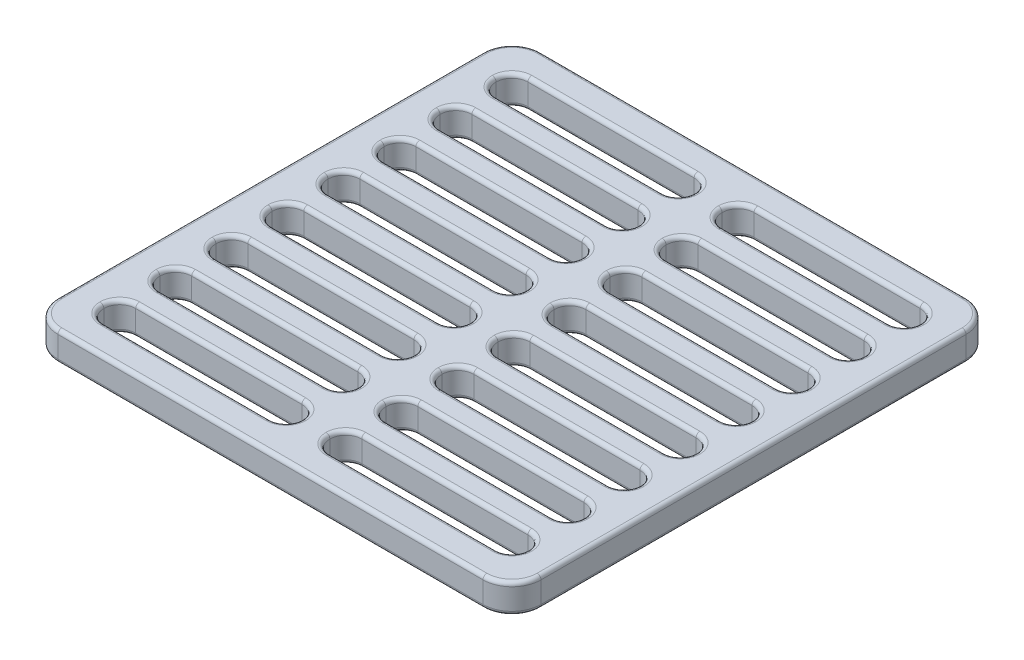
from build123d import *

# Parameters (mm, degrees)
SKETCH1_W           = 50
SKETCH1_H           = 50
BOSS_EXTRUDE1_DEPTH = 3
SKETCH4_W           = 20.5
SKETCH4_H           = 3.3
CUT_EXTRUDE2_DEPTH  = 3
FILLET3_R           = 1.65
FILLET1_R           = 3
FILLET2_R           = 0.4


with BuildPart() as part:
    # Sketch1 → Boss-Extrude1 (new body)
    with BuildSketch(Plane(origin=(0, 0, 0), x_dir=(1, 0, 0), z_dir=(0, 1, 0))):
        with Locations((25, -25)):
            Rectangle(SKETCH1_W, SKETCH1_H)
    extrude(amount=BOSS_EXTRUDE1_DEPTH)

    # Sketch4 → Cut-Extrude2 (cut)
    with BuildSketch(Plane(origin=(0, 3, 0), x_dir=(1, 0, 0), z_dir=(0, 1, 0))):
        with Locations((13.3, -4.7)):
            Rectangle(SKETCH4_W, SKETCH4_H)
        with Locations((36.7, -4.7)):
            Rectangle(SKETCH4_W, SKETCH4_H)
        with Locations((13.3, -10.5)):
            Rectangle(SKETCH4_W, SKETCH4_H)
        with Locations((36.7, -10.5)):
            Rectangle(SKETCH4_W, SKETCH4_H)
        with Locations((13.3, -16.3)):
            Rectangle(SKETCH4_W, SKETCH4_H)
        with Locations((36.7, -16.3)):
            Rectangle(SKETCH4_W, SKETCH4_H)
        with Locations((13.3, -22.1)):
            Rectangle(SKETCH4_W, SKETCH4_H)
        with Locations((36.7, -22.1)):
            Rectangle(SKETCH4_W, SKETCH4_H)
        with Locations((13.3, -27.9)):
            Rectangle(SKETCH4_W, SKETCH4_H)
        with Locations((36.7, -27.9)):
            Rectangle(SKETCH4_W, SKETCH4_H)
        with Locations((13.3, -33.7)):
            Rectangle(SKETCH4_W, SKETCH4_H)
        with Locations((36.7, -33.7)):
            Rectangle(SKETCH4_W, SKETCH4_H)
        with Locations((13.3, -39.5)):
            Rectangle(SKETCH4_W, SKETCH4_H)
        with Locations((36.7, -39.5)):
            Rectangle(SKETCH4_W, SKETCH4_H)
        with Locations((13.3, -45.3)):
            Rectangle(SKETCH4_W, SKETCH4_H)
        with Locations((36.7, -45.3)):
            Rectangle(SKETCH4_W, SKETCH4_H)
    extrude(amount=-CUT_EXTRUDE2_DEPTH, mode=Mode.SUBTRACT)

    # Fillet3
    fillet3_edges = [part.edges().sort_by_distance(p)[0] for p in [
        (23.55, 1.5, 3.05),
        (23.55, 1.5, 6.35),
        (3.05, 1.5, 6.35),
        (23.55, 1.5, 41.15),
        (3.05, 1.5, 41.15),
        (3.05, 1.5, 37.85),
        (23.55, 1.5, 37.85),
        (46.95, 1.5, 35.35),
        (26.45, 1.5, 35.35),
        (26.45, 1.5, 32.05),
        (46.95, 1.5, 32.05),
        (23.55, 1.5, 35.35),
        (3.05, 1.5, 35.35),
        (3.05, 1.5, 32.05),
        (23.55, 1.5, 32.05),
        (46.95, 1.5, 29.55),
        (26.45, 1.5, 29.55),
        (26.45, 1.5, 26.25),
        (46.95, 1.5, 26.25),
        (46.95, 1.5, 46.95),
        (26.45, 1.5, 46.95),
        (26.45, 1.5, 43.65),
        (46.95, 1.5, 43.65),
        (23.55, 1.5, 46.95),
        (3.05, 1.5, 46.95),
        (3.05, 1.5, 43.65),
        (23.55, 1.5, 43.65),
        (46.95, 1.5, 41.15),
        (26.45, 1.5, 41.15),
        (26.45, 1.5, 37.85),
        (46.95, 1.5, 37.85),
        (23.55, 1.5, 17.95),
        (3.05, 1.5, 17.95),
        (3.05, 1.5, 14.65),
        (23.55, 1.5, 14.65),
        (46.95, 1.5, 12.15),
        (26.45, 1.5, 12.15),
        (26.45, 1.5, 8.85),
        (46.95, 1.5, 8.85),
        (23.55, 1.5, 12.15),
        (3.05, 1.5, 12.15),
        (3.05, 1.5, 8.85),
        (23.55, 1.5, 8.85),
        (46.95, 1.5, 6.35),
        (26.45, 1.5, 6.35),
        (26.45, 1.5, 3.05),
        (46.95, 1.5, 3.05),
        (23.55, 1.5, 29.55),
        (3.05, 1.5, 29.55),
        (3.05, 1.5, 26.25),
        (23.55, 1.5, 26.25),
        (46.95, 1.5, 23.75),
        (26.45, 1.5, 23.75),
        (26.45, 1.5, 20.45),
        (46.95, 1.5, 20.45),
        (23.55, 1.5, 23.75),
        (3.05, 1.5, 23.75),
        (3.05, 1.5, 20.45),
        (23.55, 1.5, 20.45),
        (46.95, 1.5, 17.95),
        (26.45, 1.5, 17.95),
        (26.45, 1.5, 14.65),
        (46.95, 1.5, 14.65),
        (3.05, 1.5, 3.05),
    ]]
    fillet(fillet3_edges, radius=FILLET3_R - 0.0001)  # a hair under: the kernel refuses the full size

    # Fillet1
    fillet1_edges = [part.edges().sort_by_distance(p)[0] for p in [
        (0, 1.5, 0),
        (50, 1.5, 0),
        (50, 1.5, 50),
        (0, 1.5, 50),
    ]]
    fillet(fillet1_edges, radius=FILLET1_R)

    # Fillet2
    fillet2_edges = [part.edges().sort_by_distance(p)[0] for p in [
        (13.3, 3, 3.05),
        (13.3, 0, 3.05),
        (13.3, 3, 6.35),
        (13.3, 0, 6.35),
        (13.3, 3, 41.15),
        (13.3, 0, 41.15),
        (13.3, 3, 37.85),
        (13.3, 0, 37.85),
        (36.7, 3, 35.35),
        (36.7, 0, 35.35),
        (36.7, 3, 32.05),
        (36.7, 0, 32.05),
        (13.3, 3, 35.35),
        (13.3, 0, 35.35),
        (13.3, 3, 32.05),
        (13.3, 0, 32.05),
        (36.7, 3, 29.55),
        (36.7, 0, 29.55),
        (36.7, 3, 26.25),
        (36.7, 0, 26.25),
        (36.7, 3, 46.95),
        (36.7, 0, 46.95),
        (36.7, 3, 43.65),
        (36.7, 0, 43.65),
        (13.3, 3, 46.95),
        (13.3, 0, 46.95),
        (13.3, 3, 43.65),
        (13.3, 0, 43.65),
        (36.7, 3, 41.15),
        (36.7, 0, 41.15),
        (36.7, 3, 37.85),
        (36.7, 0, 37.85),
        (13.3, 3, 17.95),
        (13.3, 0, 17.95),
        (13.3, 3, 14.65),
        (13.3, 0, 14.65),
        (36.7, 3, 12.15),
        (36.7, 0, 12.15),
        (36.7, 3, 8.85),
        (36.7, 0, 8.85),
        (13.3, 3, 12.15),
        (13.3, 0, 12.15),
        (13.3, 3, 8.85),
        (13.3, 0, 8.85),
        (36.7, 3, 6.35),
        (36.7, 0, 6.35),
        (36.7, 3, 3.05),
        (36.7, 0, 3.05),
        (13.3, 3, 29.55),
        (13.3, 0, 29.55),
        (13.3, 3, 26.25),
        (13.3, 0, 26.25),
        (36.7, 3, 23.75),
        (36.7, 0, 23.75),
        (36.7, 3, 20.45),
        (36.7, 0, 20.45),
        (13.3, 3, 23.75),
        (13.3, 0, 23.75),
        (13.3, 3, 20.45),
        (13.3, 0, 20.45),
        (36.7, 3, 17.95),
        (36.7, 0, 17.95),
        (36.7, 3, 14.65),
        (36.7, 0, 14.65),
        (23.066755478, 3, 3.533244522),
        (23.066755478, 0, 3.533244522),
        (23.066755478, 3, 5.866755478),
        (23.066755478, 0, 5.866755478),
        (3.533244522, 3, 5.866755478),
        (3.533244522, 0, 5.866755478),
        (23.066755478, 3, 40.666755478),
        (23.066755478, 0, 40.666755478),
        (3.533244522, 3, 40.666755478),
        (3.533244522, 0, 40.666755478),
        (3.533244522, 3, 38.333244522),
        (3.533244522, 0, 38.333244522),
        (23.066755478, 3, 38.333244522),
        (23.066755478, 0, 38.333244522),
        (46.466755478, 3, 34.866755478),
        (46.466755478, 0, 34.866755478),
        (26.933244522, 3, 34.866755478),
        (26.933244522, 0, 34.866755478),
        (26.933244522, 3, 32.533244522),
        (26.933244522, 0, 32.533244522),
        (46.466755478, 3, 32.533244522),
        (46.466755478, 0, 32.533244522),
        (23.066755478, 3, 34.866755478),
        (23.066755478, 0, 34.866755478),
        (3.533244522, 3, 34.866755478),
        (3.533244522, 0, 34.866755478),
        (3.533244522, 3, 32.533244522),
        (3.533244522, 0, 32.533244522),
        (23.066755478, 3, 32.533244522),
        (23.066755478, 0, 32.533244522),
        (46.466755478, 3, 29.066755478),
        (46.466755478, 0, 29.066755478),
        (26.933244522, 3, 29.066755478),
        (26.933244522, 0, 29.066755478),
        (26.933244522, 3, 26.733244522),
        (26.933244522, 0, 26.733244522),
        (46.466755478, 3, 26.733244522),
        (46.466755478, 0, 26.733244522),
        (46.466755478, 3, 46.466755478),
        (46.466755478, 0, 46.466755478),
        (26.933244522, 3, 46.466755478),
        (26.933244522, 0, 46.466755478),
        (26.933244522, 3, 44.133244522),
        (26.933244522, 0, 44.133244522),
        (46.466755478, 3, 44.133244522),
        (46.466755478, 0, 44.133244522),
        (23.066755478, 3, 46.466755478),
        (23.066755478, 0, 46.466755478),
        (3.533244522, 3, 46.466755478),
        (3.533244522, 0, 46.466755478),
        (3.533244522, 3, 44.133244522),
        (3.533244522, 0, 44.133244522),
        (23.066755478, 3, 44.133244522),
        (23.066755478, 0, 44.133244522),
        (46.466755478, 3, 40.666755478),
        (46.466755478, 0, 40.666755478),
        (26.933244522, 3, 40.666755478),
        (26.933244522, 0, 40.666755478),
        (26.933244522, 3, 38.333244522),
        (26.933244522, 0, 38.333244522),
        (46.466755478, 3, 38.333244522),
        (46.466755478, 0, 38.333244522),
        (23.066755478, 3, 17.466755478),
        (23.066755478, 0, 17.466755478),
        (3.533244522, 3, 17.466755478),
        (3.533244522, 0, 17.466755478),
        (3.533244522, 3, 15.133244522),
        (3.533244522, 0, 15.133244522),
        (23.066755478, 3, 15.133244522),
        (23.066755478, 0, 15.133244522),
        (46.466755478, 3, 11.666755478),
        (46.466755478, 0, 11.666755478),
        (26.933244522, 3, 11.666755478),
        (26.933244522, 0, 11.666755478),
        (26.933244522, 3, 9.333244522),
        (26.933244522, 0, 9.333244522),
        (46.466755478, 3, 9.333244522),
        (46.466755478, 0, 9.333244522),
        (23.066755478, 3, 11.666755478),
        (23.066755478, 0, 11.666755478),
        (3.533244522, 3, 11.666755478),
        (3.533244522, 0, 11.666755478),
        (3.533244522, 3, 9.333244522),
        (3.533244522, 0, 9.333244522),
        (23.066755478, 3, 9.333244522),
        (23.066755478, 0, 9.333244522),
        (46.466755478, 3, 5.866755478),
        (46.466755478, 0, 5.866755478),
        (26.933244522, 3, 5.866755478),
        (26.933244522, 0, 5.866755478),
        (26.933244522, 3, 3.533244522),
        (26.933244522, 0, 3.533244522),
        (46.466755478, 3, 3.533244522),
        (46.466755478, 0, 3.533244522),
        (23.066755478, 3, 29.066755478),
        (23.066755478, 0, 29.066755478),
        (3.533244522, 3, 29.066755478),
        (3.533244522, 0, 29.066755478),
        (3.533244522, 3, 26.733244522),
        (3.533244522, 0, 26.733244522),
        (23.066755478, 3, 26.733244522),
        (23.066755478, 0, 26.733244522),
        (46.466755478, 3, 23.266755478),
        (46.466755478, 0, 23.266755478),
        (26.933244522, 3, 23.266755478),
        (26.933244522, 0, 23.266755478),
        (26.933244522, 3, 20.933244522),
        (26.933244522, 0, 20.933244522),
        (46.466755478, 3, 20.933244522),
        (46.466755478, 0, 20.933244522),
        (23.066755478, 3, 23.266755478),
        (23.066755478, 0, 23.266755478),
        (3.533244522, 3, 23.266755478),
        (3.533244522, 0, 23.266755478),
        (3.533244522, 3, 20.933244522),
        (3.533244522, 0, 20.933244522),
        (23.066755478, 3, 20.933244522),
        (23.066755478, 0, 20.933244522),
        (46.466755478, 3, 17.466755478),
        (46.466755478, 0, 17.466755478),
        (26.933244522, 3, 17.466755478),
        (26.933244522, 0, 17.466755478),
        (26.933244522, 3, 15.133244522),
        (26.933244522, 0, 15.133244522),
        (46.466755478, 3, 15.133244522),
        (46.466755478, 0, 15.133244522),
        (3.533244522, 3, 3.533244522),
        (3.533244522, 0, 3.533244522),
        (0, 0, 25),
        (0, 3, 25),
        (25, 0, 0),
        (50, 0, 25),
        (25, 0, 50),
        (0.878679656, 0, 49.121320344),
        (49.121320344, 0, 49.121320344),
        (49.121320344, 0, 0.878679656),
        (0.878679656, 0, 0.878679656),
        (25, 3, 0),
        (25, 3, 50),
        (50, 3, 25),
        (0.878679656, 3, 49.121320344),
        (49.121320344, 3, 49.121320344),
        (49.121320344, 3, 0.878679656),
        (0.878679656, 3, 0.878679656),
    ]]
    fillet(fillet2_edges, radius=FILLET2_R)


solid = part.part
